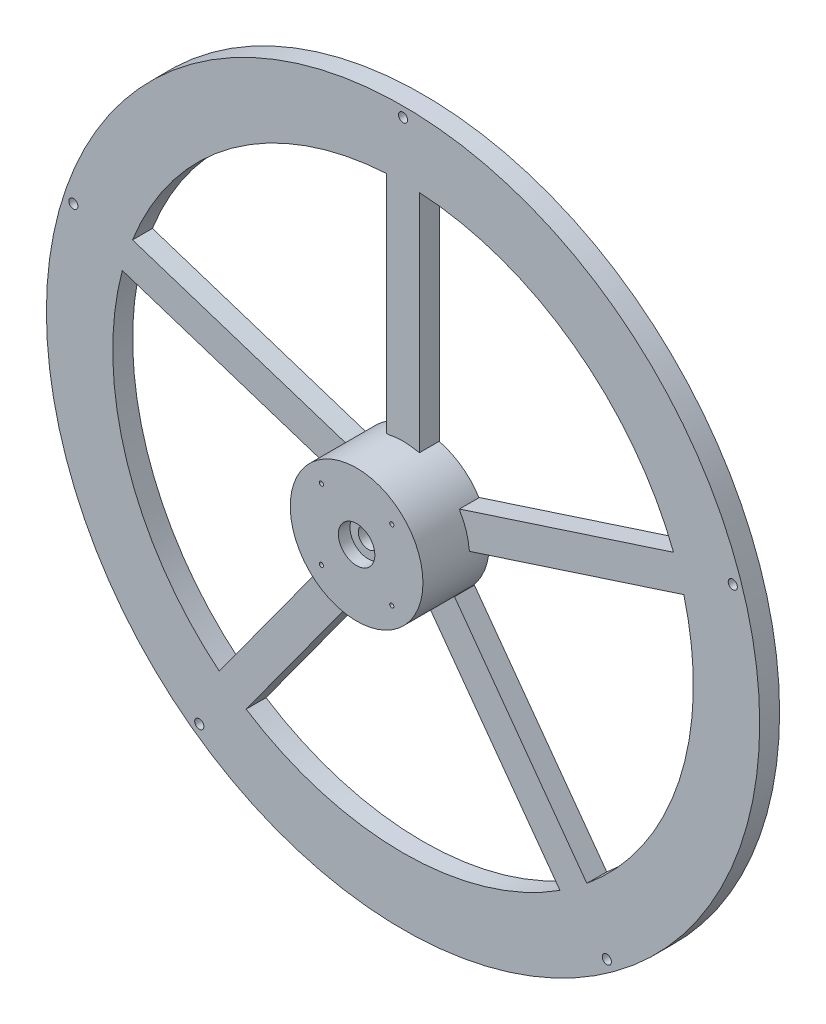
from build123d import *

# Parameters (mm, degrees)
SKETCH1_R               = 215
SKETCH1_R_2             = 175
RING_DEPTH              = 12
SKETCH2_R               = 40
HUB_DEPTH               = 40
SKETCH3_W               = 20
SKETCH3_H               = 137
SPOKES_DEPTH            = 12
SKETCH4_R               = 6
BORE_DEPTH              = 40
SKETCH5_R               = 11
BEARING_SEAT_LOW_DEPTH  = 7
SKETCH6_R               = 11
BEARING_SEAT_HIGH_DEPTH = 7
SKETCH7_R               = 184
SKETCH7_R_2             = 179
BAND_SEAT_DEPTH         = 3
SKETCH8_R               = 2.75
ROD_HOLES_DEPTH         = 12
SKETCH9_R               = 1.25
GROMMET_SCREWS_DEPTH    = 8


with BuildPart() as part:
    # Sketch1 → Ring (new body)
    with BuildSketch(Plane.XY):
        Circle(SKETCH1_R)
        Circle(SKETCH1_R_2, mode=Mode.SUBTRACT)
    extrude(amount=RING_DEPTH)



with BuildPart() as body_2:
    # Sketch2 → Hub (new body)
    with BuildSketch(Plane.XY):
        Circle(SKETCH2_R)
    extrude(amount=HUB_DEPTH)


with BuildPart() as part_1:
    add(part.part)

    add(body_2.part)  # Spokes merges body 2
    # Sketch3 → Spokes (add)
    with BuildSketch(Plane.XY):
        Polygon((40.181374079, 2.541097618), (170.476116812, 44.876425847), (164.295776924, 63.897556173), (34.001034192, 21.562227944), align=None)
        with Locations((0, 107.5)):
            Rectangle(SKETCH3_W, SKETCH3_H)
        Polygon((-34.001034192, 21.562227944), (-164.295776924, 63.897556173), (-170.476116812, 44.876425847), (-40.181374079, 2.541097618), align=None)
        Polygon((-31.013794783, -25.673810258), (-111.540374347, -136.509138487), (-95.36003446, -148.264843533), (-14.833454896, -37.429515304), align=None)
        Polygon((14.833454896, -37.429515304), (95.36003446, -148.264843533), (111.540374347, -136.509138487), (31.013794783, -25.673810258), align=None)
    extrude(amount=SPOKES_DEPTH)

    # Sketch4 → Bore (cut)
    with BuildSketch(Plane.XY):
        Circle(SKETCH4_R)
    extrude(amount=BORE_DEPTH, mode=Mode.SUBTRACT)

    # Sketch5 → Bearing_seat_low (cut)
    with BuildSketch(Plane.XY):
        Circle(SKETCH5_R)
    extrude(amount=BEARING_SEAT_LOW_DEPTH, mode=Mode.SUBTRACT)

    # Sketch6 → Bearing_seat_high (cut)
    with BuildSketch(Plane.XY.offset(33)):
        Circle(SKETCH6_R)
    extrude(amount=BEARING_SEAT_HIGH_DEPTH, mode=Mode.SUBTRACT)

    # Sketch7 → Band_seat (cut)
    with BuildSketch(Plane.XY):
        Circle(SKETCH7_R)
        Circle(SKETCH7_R_2, mode=Mode.SUBTRACT)
    extrude(amount=BAND_SEAT_DEPTH, mode=Mode.SUBTRACT)

    # Sketch8 → Rod_holes (cut)
    with BuildSketch(Plane.XY):
        with Locations((198.770811906, 64.584551824)):
            Circle(SKETCH8_R)
        with Locations((0, 209)):
            Circle(SKETCH8_R)
        with Locations((-198.770811906, 64.584551824)):
            Circle(SKETCH8_R)
        with Locations((-122.847117729, -169.084551824)):
            Circle(SKETCH8_R)
        with Locations((122.847117729, -169.084551824)):
            Circle(SKETCH8_R)
    extrude(amount=ROD_HOLES_DEPTH, mode=Mode.SUBTRACT)

    # Sketch9 → Grommet_screws (cut)
    with BuildSketch(Plane.XY.offset(32)):
        with Locations((21.213203436, 21.213203436)):
            Circle(SKETCH9_R)
        with Locations((-21.213203436, 21.213203436)):
            Circle(SKETCH9_R)
        with Locations((-21.213203436, -21.213203436)):
            Circle(SKETCH9_R)
        with Locations((21.213203436, -21.213203436)):
            Circle(SKETCH9_R)
    extrude(amount=GROMMET_SCREWS_DEPTH, mode=Mode.SUBTRACT)


solid = part_1.part
